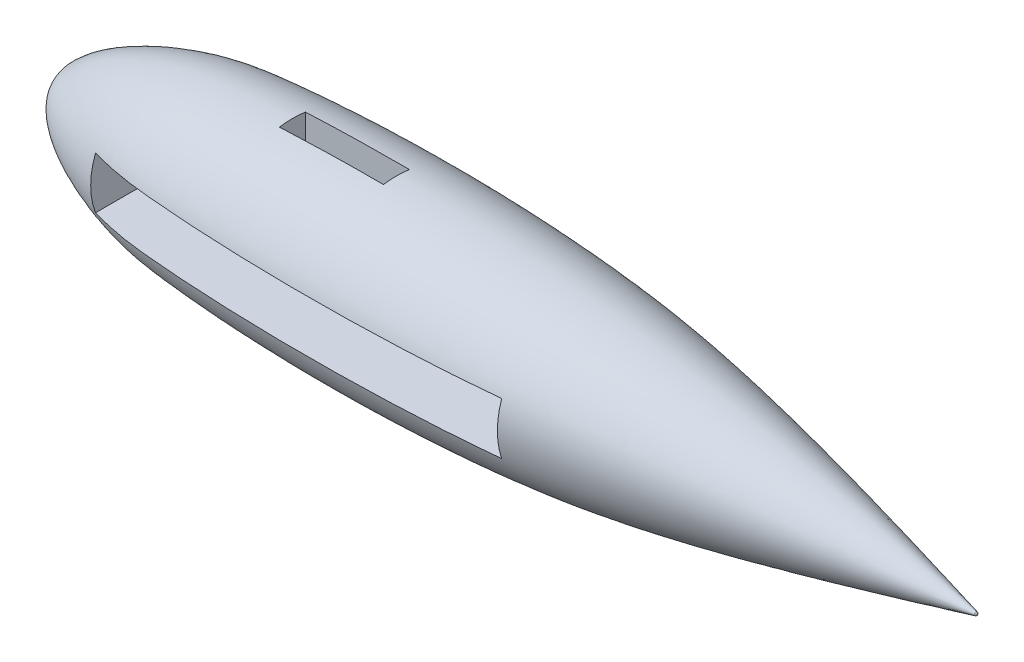
from build123d import *

# Parameters (mm, degrees)
ESQUISSE2_W             = 80
ESQUISSE2_H             = 10
ENL_V_MAT_EXTRU_1_DEPTH = 179.691922833
ESQUISSE3_W             = 20
ESQUISSE3_H             = 5
ENL_V_MAT_EXTRU_2_DEPTH = 179.307729192


# Read off the part's stored shape, not the designer's step: Révolution1
with BuildPart() as part:
    # Révolution1 outline → Révolution1 (revolve)
    with BuildSketch(Plane.YX):
        with BuildLine():
            Line((0, 176.471881523), (0, 0.450442526))
            add(Edge.make_bspline(
                [(0, 0.450442526), (0.103361961, 0.443495603), (0.206543876, 0.439844859), (0.309534668, 0.439429886)],
                knots=[0, 0, 0, 0, 0.003398392, 0.003398392, 0.003398392, 0.003398392], degree=3))
            Line((0.309534668, 0.439429886), (0.309534507, 176.471881524))
            Line((0.309534507, 176.471881524), (0, 176.471881523))
        make_face()
        with BuildLine():
            Line((0.309534512, 176.471881525), (0.309534668, 0.439429886))
            add(Edge.make_bspline(
                [(0.309534668, 0.439429886), (6.884526451, 0.412937715), (14.509743766, 17.727772952), (16.667676996, 39.398599443), (17.192832586, 53.387091856), (17.192832592, 63.948829317)],
                knots=[0.003398392, 0.003398392, 0.003398392, 0.003398392, 0.220353687, 0.288822515, 0.48156816, 0.48156816, 0.48156816, 0.48156816], degree=3))
            add(Edge.make_bspline(
                [(17.192832592, 63.948829317), (17.192832597, 72.668831581), (16.803343845, 85.767940858), (14.588524885, 112.977693153), (10.609009478, 135.742405432), (0.309534512, 176.471881525)],
                knots=[0.48156816, 0.48156816, 0.48156816, 0.48156816, 0.640703195, 0.716219452, 0.999999875, 0.999999875, 0.999999875, 0.999999875], degree=3))
        make_face()
        with BuildLine():
            Line((0, 176.712929062), (0, 176.471881523))
            Line((0, 176.471881523), (0.309534507, 176.471881523))
            ThreePointArc((0.309534507, 176.471881523), (0.196160347, 176.645559085), (0, 176.712929062))
        make_face()
    revolve(axis=Axis((0, 0, 0), (1, 0, 0)))

    # Esquisse2 → Enlèv. mat.-Extru.1 (cut, through all)
    with BuildSketch(Plane.XY.offset(3)):
        with Locations((60, 0)):
            Rectangle(ESQUISSE2_W, ESQUISSE2_H)
    enl_v_mat_extru_1 = extrude(amount=ENL_V_MAT_EXTRU_1_DEPTH, mode=Mode.SUBTRACT)

    # Symétrie1: Enlèv. mat.-Extru.1 across plane
    add(enl_v_mat_extru_1.mirror(Plane.XY), mode=Mode.SUBTRACT)

    # Esquisse3 → Enlèv. mat.-Extru.2 (cut, through all)
    with BuildSketch(Plane(origin=(0, 0, 0), x_dir=(1, 0, 0), z_dir=(0, 1, 0))):
        with Locations((55, 0)):
            Rectangle(ESQUISSE3_W, ESQUISSE3_H)
    extrude(amount=ENL_V_MAT_EXTRU_2_DEPTH, mode=Mode.SUBTRACT)


solid = part.part
